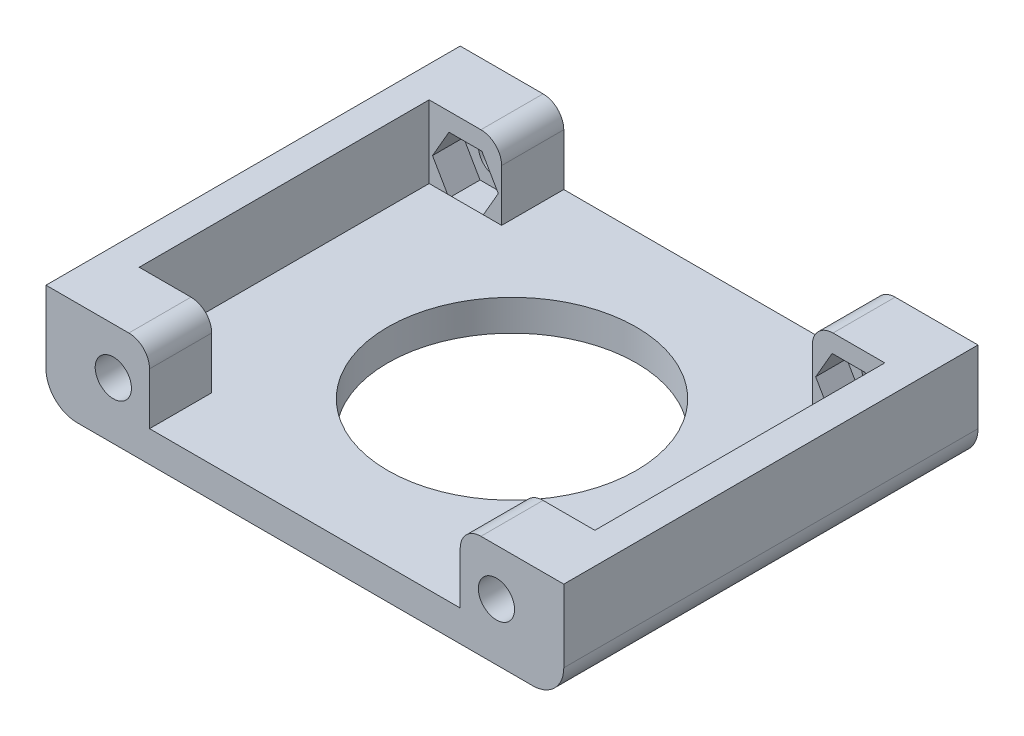
from build123d import *

# Parameters (mm, degrees)
SKETCH1_W            = 50
SKETCH1_H            = 40
BOSS_EXTRUDE1_DEPTH  = 3
SKETCH2_R            = 12
CUT_EXTRUDE1_DEPTH   = 33.155870382
SKETCH3_W            = 3
SKETCH3_H            = 40
BOSS_EXTRUDE2_DEPTH  = 7
SKETCH4_W            = 7
SKETCH4_H            = 7
BOSS_EXTRUDE3_DEPTH  = 6
SKETCH5_R            = 1.75
CUT_EXTRUDE2_DEPTH   = 49.218253805
CUT_EXTRUDE3_DEPTH   = 3
MIRROR3_COPY_1_DEPTH = 3
MIRROR3_COPY_2_DEPTH = 3
FILLET1_R            = 3
FILLET2_R            = 2


with BuildPart() as part:
    # Sketch1 → Boss-Extrude1 (new body)
    with BuildSketch(Plane(origin=(0, 0, 0), x_dir=(1, 0, 0), z_dir=(0, 1, 0))):
        Rectangle(SKETCH1_W, SKETCH1_H)
    extrude(amount=BOSS_EXTRUDE1_DEPTH)

    # Sketch2 → Cut-Extrude1 (cut, through all)
    with BuildSketch(Plane(origin=(0, 3, 0), x_dir=(1, 0, 0), z_dir=(0, 1, 0))):
        Circle(SKETCH2_R)
    extrude(amount=-CUT_EXTRUDE1_DEPTH, mode=Mode.SUBTRACT)

    # Sketch3 → Boss-Extrude2 (add)
    with BuildSketch(Plane(origin=(0, 3, 0), x_dir=(1, 0, 0), z_dir=(0, 1, 0))):
        with Locations((-23.5, 0)):
            Rectangle(SKETCH3_W, SKETCH3_H)
        with Locations((23.5, 0)):
            Rectangle(SKETCH3_W, SKETCH3_H)
    extrude(amount=BOSS_EXTRUDE2_DEPTH)

    # Sketch4 → Boss-Extrude3 (add)
    with BuildSketch(Plane.XY.offset(20)):
        with Locations((-18.5, 6.5)):
            Rectangle(SKETCH4_W, SKETCH4_H)
        with Locations((18.5, 6.5)):
            Rectangle(SKETCH4_W, SKETCH4_H)
    boss_extrude3 = extrude(amount=-BOSS_EXTRUDE3_DEPTH)

    # Sketch5 → Cut-Extrude2 (cut, through all)
    with BuildSketch(Plane.XY.offset(20)):
        with Locations((-18.5, 5.5)):
            Circle(SKETCH5_R)
        with Locations((18.5, 5.5)):
            Circle(SKETCH5_R)
    cut_extrude2 = extrude(amount=-CUT_EXTRUDE2_DEPTH, mode=Mode.SUBTRACT)

    # Mirror1: Boss-Extrude3, Cut-Extrude2 across plane
    add(boss_extrude3.mirror(Plane.XY))
    add(cut_extrude2.mirror(Plane.XY), mode=Mode.SUBTRACT)

    # Sketch6 → Cut-Extrude3 (cut)
    with BuildSketch(Plane.XY.offset(-14)):
        Polygon((-15.324573519, 5.5), (-16.91228676, 8.25), (-20.08771324, 8.25), (-21.675426481, 5.5), (-20.08771324, 2.75), (-16.91228676, 2.75), align=None)
    cut_extrude3 = extrude(amount=-CUT_EXTRUDE3_DEPTH, mode=Mode.SUBTRACT)

    # Mirror2: Cut-Extrude3 across plane
    add(cut_extrude3.mirror(Plane(origin=(0, 0, 0), x_dir=(0, 0, 1), z_dir=(1, 0, 0))), mode=Mode.SUBTRACT)

    # Mirror3 copy 1 sketch → Mirror3 copy 1 (cut)
    with BuildSketch(Plane(origin=(0, 0, 14), x_dir=(-1, 0, 0), z_dir=(0, 0, -1))):
        Polygon((-15.324573519, 5.5), (-16.91228676, 8.25), (-20.08771324, 8.25), (-21.675426481, 5.5), (-20.08771324, 2.75), (-16.91228676, 2.75), align=None)
    extrude(amount=-MIRROR3_COPY_1_DEPTH, mode=Mode.SUBTRACT)

    # Mirror3 copy 2 sketch → Mirror3 copy 2 (cut)
    with BuildSketch(Plane(origin=(0, 0, 14), x_dir=(1, 0, 0), z_dir=(0, 0, -1))):
        Polygon((-15.324573519, -5.5), (-16.91228676, -8.25), (-20.08771324, -8.25), (-21.675426481, -5.5), (-20.08771324, -2.75), (-16.91228676, -2.75), align=None)
    extrude(amount=-MIRROR3_COPY_2_DEPTH, mode=Mode.SUBTRACT)

    # Fillet1
    fillet1_edges = [part.edges().sort_by_distance(p)[0] for p in [
        (-25, 0, 0),
        (25, 0, 0),
    ]]
    fillet(fillet1_edges, radius=FILLET1_R)

    # Fillet2
    fillet2_edges = [part.edges().sort_by_distance(p)[0] for p in [
        (15, 10, 17),
        (15, 10, -17),
        (-15, 10, -17),
        (-15, 10, 17),
    ]]
    fillet(fillet2_edges, radius=FILLET2_R)


solid = part.part
